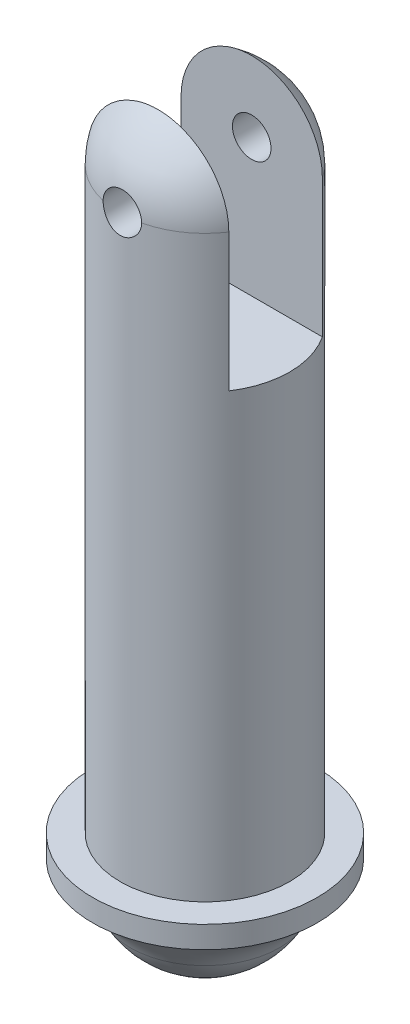
from build123d import *

# Parameters (mm, degrees)
CUT_EXTRUDE1_DEPTH      = 17.064109466
CUT_EXTRUDE1_DEPTH_BACK = 17.064109466
SKETCH2_W               = 2.159
SKETCH2_H               = 5.314367205
CUT_EXTRUDE2_DEPTH      = 17.064109466
CUT_EXTRUDE2_DEPTH_BACK = 17.064109466
SKETCH3_R               = 0.4445
BOSS_EXTRUDE8_START     = -0.508
SKETCH4_R               = 2.5908
SKETCH4_R_2             = 1.9558
BOSS_EXTRUDE8_DEPTH     = 0.508
FILLET1_R               = 2.54


with BuildPart() as part:
    # Sketch1 one side → Revolve1 (revolve)
    with BuildSketch(Plane.XY):
        with BuildLine():
            Line((1.9558, -13.8684), (1.9558, 0))
            ThreePointArc((1.9558, 0), (1.382959443, 1.382959443), (0, 1.9558))
            Line((0, 1.9558), (0, -15.8242))
            ThreePointArc((0, -15.8242), (1.382959443, -15.251359443), (1.9558, -13.8684))
        make_face()
    revolve(axis=Axis((0, 0, 0), (0, -1, 0)))

    # Sketch2 → Cut-Extrude1 (cut, two sides: drawn at the far end of the back side and taken through both)
    with BuildSketch(Plane(origin=(0, 0, 0), x_dir=(0, 0, -1), z_dir=(1, 0, 0)).offset(-CUT_EXTRUDE1_DEPTH_BACK)):
        with Locations((0, -0.517816398)):
            Rectangle(SKETCH2_W, SKETCH2_H)
    extrude(amount=CUT_EXTRUDE1_DEPTH + CUT_EXTRUDE1_DEPTH_BACK, mode=Mode.SUBTRACT)

    # Sketch3 → Cut-Extrude2 (cut, two sides: drawn at the far end of the back side and taken through both)
    with BuildSketch(Plane.XY.offset(-CUT_EXTRUDE2_DEPTH_BACK)):
        Circle(SKETCH3_R)
    extrude(amount=CUT_EXTRUDE2_DEPTH + CUT_EXTRUDE2_DEPTH_BACK, mode=Mode.SUBTRACT)

    # Sketch4 → Boss-Extrude8 (add)
    with BuildSketch(Plane(origin=(0, -13.8684, 0), x_dir=(-1, 0, 0), z_dir=(0, -1, 0)).offset(BOSS_EXTRUDE8_START)):
        with Locations(Location((0, 0, 0), (0, 0, 90))):
            Circle(SKETCH4_R)
        with Locations(Location((0, 0, 0), (0, 0, 213.500760385))):
            Circle(SKETCH4_R_2, mode=Mode.SUBTRACT)
    extrude(amount=BOSS_EXTRUDE8_DEPTH)

    # Fillet1
    # the kernel refuses this fillet: 2.54 mm, written as the material it adds along each edge
    with BuildSketch(Plane(origin=(0, -13.8684, 0), x_dir=(1, 0, 0), z_dir=(0, 0, -1))) as fillet1_piece_1:
        with BuildLine():
            CenterArc((3.951069608, 2.145056315), FILLET1_R, 208.497766198, 29.121746718)
            Line((2.5908, 0), (2.563594608, -0.042901126))
            ThreePointArc((2.563594608, -0.042901126), (2.2733, -0.0508), (1.9558, -0.0508))
            Line((1.9558, -0.0508), (1.905, 0))
            ThreePointArc((1.905, 0), (1.846394024, 0.46888603), (1.674182037, 0.908922167))
            Line((1.674182037, 0.908922167), (1.718826892, 0.933160092))
        make_face()
    revolve(axis=Axis((0, -13.8684, 0), (0, -1, 0)))


solid = part.part
